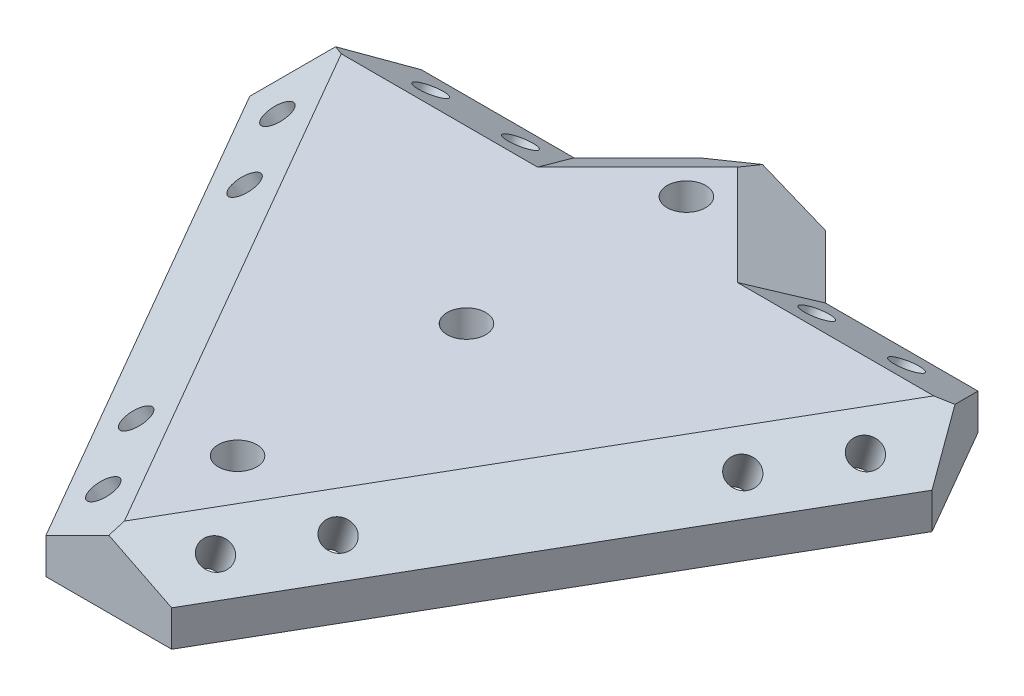
from build123d import *

# Parameters (mm, degrees)
SKETCH1_R           = 2.15
BOSS_EXTRUDE1_DEPTH = 8
CHAMFER1_SIZE       = 4
CHAMFER1_SIZE_2     = 6.92820323
CUT_EXTRUDE1_REACH  = 62.128
SKETCH2_R           = 1.6
CUT_EXTRUDE2_REACH  = 68.128
CUT_EXTRUDE2_START  = -6
SKETCH3_R           = 3
CIRPATTERN1_COUNT   = 3


with BuildPart() as part:
    # Sketch1 → Boss-Extrude1 (new body)
    with BuildSketch(Plane(origin=(0, 0, 0), x_dir=(1, 0, 0), z_dir=(0, 1, 0))):
        Polygon((-31, 25.980762114), (-14, 25.980762114), (-7, 32.980762114), (7, 32.980762114), (14, 25.980762114), (31, 25.980762114), (38, 13.856406461), (7, -39.837168574), (-7, -39.837168574), (-38, 13.856406461), align=None)
        with Locations(Location((0, 24.5, 0), (0, 0, 270))):
            Circle(SKETCH1_R, mode=Mode.SUBTRACT)
        with Locations(Location((0, -25.5, 0), (0, 0, 270))):
            Circle(SKETCH1_R, mode=Mode.SUBTRACT)
        with Locations(Location((0, 0, 0), (0, 0, 270))):
            Circle(SKETCH1_R, mode=Mode.SUBTRACT)
    extrude(amount=BOSS_EXTRUDE1_DEPTH)

    # Chamfer1
    # the kernel refuses this chamfer: 6.92820323, 4 mm, written as the material it takes off along each edge
    with BuildSketch(Plane(origin=(46.961927941, 8, -29.378920988), x_dir=(0.05013755556391488, -0.9983227437537926, 0.028946931201335895), z_dir=(-0.49999999999999767, 0, 0.86602540378444)), Plane(origin=(1.961927941, 8, 55.359683102), x_dir=(-0.05013755556391399, -0.9983227437537926, 0.02894693120133537), z_dir=(-0.49999999999999756, 0, -0.8660254037844402))) as chamfer1_piece_1:
        Polygon((CHAMFER1_SIZE * 0.998322743754, -CHAMFER1_SIZE * 0.0578938624027), (-CHAMFER1_SIZE_2 * 0.057893862405, -CHAMFER1_SIZE_2 * 0.998322743793), (0, 0), align=None)
    extrude(amount=97.847711765, mode=Mode.SUBTRACT)
    with BuildSketch(Plane(origin=(-3.923855882, 8, -25.980762114), x_dir=(0, -0.9983227437537926, -0.05789386240267147), z_dir=(1, 0, 0))) as chamfer1_piece_2_section:
        Polygon((CHAMFER1_SIZE * 0.998322743754, -CHAMFER1_SIZE * 0.0578938624027), (-CHAMFER1_SIZE_2 * 0.057893862405, -CHAMFER1_SIZE_2 * 0.998322743793), (0, 0), align=None)
    chamfer1_piece_2 = extrude(amount=52.847711765, mode=Mode.PRIVATE)
    chamfer1_piece_2 = split(chamfer1_piece_2, bisect_by=Plane(origin=(24.400878633, 6.686948716, -15.57988348), z_dir=(0.7071067811865477, 0, -0.7071067811865475)), keep=Keep.TOP, mode=Mode.PRIVATE)
    add(chamfer1_piece_2, mode=Mode.SUBTRACT)
    with BuildSketch(Plane(origin=(-5.674080039, 8, -45.654842153), x_dir=(0.04093714269400996, -0.9983227437537926, -0.04093714269400995), z_dir=(0.7071067811865475, 0, 0.7071067811865477))) as chamfer1_piece_3_section:
        Polygon((CHAMFER1_SIZE * 0.998322743754, -CHAMFER1_SIZE * 0.0578938624027), (-CHAMFER1_SIZE_2 * 0.057893862405, -CHAMFER1_SIZE_2 * 0.998322743793), (0, 0), align=None)
    chamfer1_piece_3 = extrude(amount=45.747206701, mode=Mode.PRIVATE)
    chamfer1_piece_3 = split(chamfer1_piece_3, bisect_by=Plane(origin=(1.830005366, 6.678491599, -25.980762114), z_dir=(0, 0, -1)), keep=Keep.TOP, mode=Mode.PRIVATE)
    add(chamfer1_piece_3, mode=Mode.SUBTRACT)
    with BuildSketch(Plane(origin=(-26.674080039, 8, -13.306682074), x_dir=(-0.04093714269400995, -0.9983227437537926, -0.04093714269400996), z_dir=(0.7071067811865477, 0, -0.7071067811865474))) as chamfer1_piece_4_section:
        Polygon((CHAMFER1_SIZE * 0.998322743754, -CHAMFER1_SIZE * 0.0578938624027), (-CHAMFER1_SIZE_2 * 0.057893862405, -CHAMFER1_SIZE_2 * 0.998322743793), (0, 0), align=None)
    chamfer1_piece_4 = extrude(amount=45.747206701, mode=Mode.PRIVATE)
    chamfer1_piece_4 = split(chamfer1_piece_4, bisect_by=Plane(origin=(-1.830005366, 6.678491599, -25.980762114), z_dir=(0, 0, -1)), keep=Keep.TOP, mode=Mode.PRIVATE)
    add(chamfer1_piece_4, mode=Mode.SUBTRACT)
    with BuildSketch(Plane(origin=(-48.923855882, 8, -25.980762114), x_dir=(0, -0.9983227437537926, -0.05789386240267147), z_dir=(1, 0, 0))) as chamfer1_piece_5_section:
        Polygon((CHAMFER1_SIZE * 0.998322743754, -CHAMFER1_SIZE * 0.0578938624027), (-CHAMFER1_SIZE_2 * 0.057893862405, -CHAMFER1_SIZE_2 * 0.998322743793), (0, 0), align=None)
    chamfer1_piece_5 = extrude(amount=52.847711765, mode=Mode.PRIVATE)
    chamfer1_piece_5 = split(chamfer1_piece_5, bisect_by=Plane(origin=(-24.400878633, 6.686948716, -15.57988348), z_dir=(-0.7071067811865474, 0, -0.7071067811865477)), keep=Keep.TOP, mode=Mode.PRIVATE)
    add(chamfer1_piece_5, mode=Mode.SUBTRACT)
    with BuildSketch(Plane(origin=(-5.674080039, 8, -45.654842153), x_dir=(0.04093714269400996, -0.9983227437537926, -0.04093714269400995), z_dir=(0.7071067811865475, 0, 0.7071067811865477))) as chamfer1_piece_6a_section:
        Polygon((CHAMFER1_SIZE * 0.998322743754, -CHAMFER1_SIZE * 0.0578938624027), (-CHAMFER1_SIZE_2 * 0.057893862405, -CHAMFER1_SIZE_2 * 0.998322743793), (0, 0), align=None)
    chamfer1_piece_6a = extrude(amount=45.747206701, mode=Mode.PRIVATE)
    chamfer1_piece_6a = split(chamfer1_piece_6a, bisect_by=Plane(origin=(17.706766412, 6.766221652, -25.980762114), z_dir=(0, 0, 1)), keep=Keep.TOP, mode=Mode.PRIVATE)
    with BuildSketch(Plane(origin=(-3.923855882, 8, -25.980762114), x_dir=(0, -0.9983227437537926, -0.05789386240267147), z_dir=(1, 0, 0))) as chamfer1_piece_6b_section:
        Polygon((CHAMFER1_SIZE * 0.998322743754, -CHAMFER1_SIZE * 0.0578938624027), (-CHAMFER1_SIZE_2 * 0.057893862405, -CHAMFER1_SIZE_2 * 0.998322743793), (0, 0), align=None)
    chamfer1_piece_6b = extrude(amount=52.847711765, mode=Mode.PRIVATE)
    chamfer1_piece_6b = split(chamfer1_piece_6b, bisect_by=Plane(origin=(11.378920334, 6.766221652, -28.60184178), z_dir=(-0.7071067811865477, 0, 0.7071067811865475)), keep=Keep.TOP, mode=Mode.PRIVATE)
    chamfer1_piece_6 = chamfer1_piece_6a & chamfer1_piece_6b
    add(chamfer1_piece_6, mode=Mode.SUBTRACT)
    with BuildSketch(Plane(origin=(-48.923855882, 8, -25.980762114), x_dir=(0, -0.9983227437537926, -0.05789386240267147), z_dir=(1, 0, 0))) as chamfer1_piece_7a_section:
        Polygon((CHAMFER1_SIZE * 0.998322743754, -CHAMFER1_SIZE * 0.0578938624027), (-CHAMFER1_SIZE_2 * 0.057893862405, -CHAMFER1_SIZE_2 * 0.998322743793), (0, 0), align=None)
    chamfer1_piece_7a = extrude(amount=52.847711765, mode=Mode.PRIVATE)
    chamfer1_piece_7a = split(chamfer1_piece_7a, bisect_by=Plane(origin=(-11.378920334, 6.766221652, -28.60184178), z_dir=(0.7071067811865474, 0, 0.7071067811865477)), keep=Keep.TOP, mode=Mode.PRIVATE)
    with BuildSketch(Plane(origin=(-26.674080039, 8, -13.306682074), x_dir=(-0.04093714269400995, -0.9983227437537926, -0.04093714269400996), z_dir=(0.7071067811865477, 0, -0.7071067811865474))) as chamfer1_piece_7b_section:
        Polygon((CHAMFER1_SIZE * 0.998322743754, -CHAMFER1_SIZE * 0.0578938624027), (-CHAMFER1_SIZE_2 * 0.057893862405, -CHAMFER1_SIZE_2 * 0.998322743793), (0, 0), align=None)
    chamfer1_piece_7b = extrude(amount=45.747206701, mode=Mode.PRIVATE)
    chamfer1_piece_7b = split(chamfer1_piece_7b, bisect_by=Plane(origin=(-17.706766412, 6.766221652, -25.980762114), z_dir=(0, 0, 1)), keep=Keep.TOP, mode=Mode.PRIVATE)
    chamfer1_piece_7 = chamfer1_piece_7a & chamfer1_piece_7b
    add(chamfer1_piece_7, mode=Mode.SUBTRACT)

    # Cut-Extrude1: up to this plane
    cut_extrude1_end = Plane(origin=(0, 0, 0), z_dir=(0, -1, 0))
    # Sketch2 → Cut-Extrude1 (cut, up to the surface)
    with BuildSketch(Plane(origin=(7.125, 14.25, 4.113620668), x_dir=(0.9013878188659966, -0.41602514716892336, -0.12009611535381544), z_dir=(0.43301270189222085, 0.8660254037844383, 0.24999999999999917)), mode=Mode.PRIVATE) as cut_extrude1_sk1:
        with Locations(Location((28.428385057, 12.896779562, 0), (0, 0, 172.874983651))):
            Circle(SKETCH2_R)
    cut_extrude1_tool1 = split(extrude(cut_extrude1_sk1.sketch, amount=-CUT_EXTRUDE1_REACH, mode=Mode.PRIVATE), bisect_by=cut_extrude1_end, keep=Keep.BOTH, mode=Mode.PRIVATE)
    # Sketch2 → Cut-Extrude1 (cut, up to the surface)
    with BuildSketch(Plane(origin=(7.125, 14.25, 4.113620668), x_dir=(0.9013878188659966, -0.41602514716892336, -0.12009611535381544), z_dir=(0.43301270189222085, 0.8660254037844383, 0.24999999999999917)), mode=Mode.PRIVATE) as cut_extrude1_sk2:
        with Locations(Location((-0.970725343, -31.201886038, 0), (0, 0, 172.874983651))):
            Circle(SKETCH2_R)
    cut_extrude1_tool2 = split(extrude(cut_extrude1_sk2.sketch, amount=-CUT_EXTRUDE1_REACH, mode=Mode.PRIVATE), bisect_by=cut_extrude1_end, keep=Keep.BOTH, mode=Mode.PRIVATE)
    # Sketch2 → Cut-Extrude1 (cut, up to the surface)
    with BuildSketch(Plane(origin=(7.125, 14.25, 4.113620668), x_dir=(0.9013878188659966, -0.41602514716892336, -0.12009611535381544), z_dir=(0.43301270189222085, 0.8660254037844383, 0.24999999999999917)), mode=Mode.PRIVATE) as cut_extrude1_sk3:
        with Locations(Location((4.576276619, -22.881383094, 0), (0, 0, 172.874983651))):
            Circle(SKETCH2_R)
    cut_extrude1_tool3 = split(extrude(cut_extrude1_sk3.sketch, amount=-CUT_EXTRUDE1_REACH, mode=Mode.PRIVATE), bisect_by=cut_extrude1_end, keep=Keep.BOTH, mode=Mode.PRIVATE)
    # Sketch2 → Cut-Extrude1 (cut, up to the surface)
    with BuildSketch(Plane(origin=(7.125, 14.25, 4.113620668), x_dir=(0.9013878188659966, -0.41602514716892336, -0.12009611535381544), z_dir=(0.43301270189222085, 0.8660254037844383, 0.24999999999999917)), mode=Mode.PRIVATE) as cut_extrude1_sk4:
        with Locations(Location((22.881383094, 4.576276619, 0), (0, 0, 172.874983651))):
            Circle(SKETCH2_R)
    cut_extrude1_tool4 = split(extrude(cut_extrude1_sk4.sketch, amount=-CUT_EXTRUDE1_REACH, mode=Mode.PRIVATE), bisect_by=cut_extrude1_end, keep=Keep.BOTH, mode=Mode.PRIVATE)
    cut_extrude1 = cut_extrude1_tool1.solids().sort_by_distance((32.75, 6, -11.691343))[0] + cut_extrude1_tool2.solids().sort_by_distance((6.25, 6, 34.208003))[0] + cut_extrude1_tool3.solids().sort_by_distance((11.25, 6, 25.547749))[0] + cut_extrude1_tool4.solids().sort_by_distance((27.75, 6, -3.031089))[0]
    add(cut_extrude1, mode=Mode.SUBTRACT)

    # Sketch3 → Cut-Extrude2 (cut, up to next)
    with BuildSketch(Plane(origin=(7.125, 14.25, 4.113620668), x_dir=(0.9013878188659967, -0.41602514716892325, -0.12009611535381544), z_dir=(0.43301270189222074, 0.8660254037844383, 0.24999999999999925)).offset(CUT_EXTRUDE2_START), mode=Mode.PRIVATE) as cut_extrude2_sk1:
        with Locations((28.428385057, 12.896779562)):
            Circle(SKETCH3_R)
    cut_extrude2_tool1 = extrude(cut_extrude2_sk1.sketch, amount=-CUT_EXTRUDE2_REACH, mode=Mode.PRIVATE) & part.part
    # Sketch3 → Cut-Extrude2 (cut, up to next)
    with BuildSketch(Plane(origin=(7.125, 14.25, 4.113620668), x_dir=(0.9013878188659967, -0.41602514716892325, -0.12009611535381544), z_dir=(0.43301270189222074, 0.8660254037844383, 0.24999999999999925)).offset(CUT_EXTRUDE2_START), mode=Mode.PRIVATE) as cut_extrude2_sk2:
        with Locations((-0.970725343, -31.201886038)):
            Circle(SKETCH3_R)
    cut_extrude2_tool2 = extrude(cut_extrude2_sk2.sketch, amount=-CUT_EXTRUDE2_REACH, mode=Mode.PRIVATE) & part.part
    # Sketch3 → Cut-Extrude2 (cut, up to next)
    with BuildSketch(Plane(origin=(7.125, 14.25, 4.113620668), x_dir=(0.9013878188659967, -0.41602514716892325, -0.12009611535381544), z_dir=(0.43301270189222074, 0.8660254037844383, 0.24999999999999925)).offset(CUT_EXTRUDE2_START), mode=Mode.PRIVATE) as cut_extrude2_sk3:
        with Locations((22.881383094, 4.576276619)):
            Circle(SKETCH3_R)
    cut_extrude2_tool3 = extrude(cut_extrude2_sk3.sketch, amount=-CUT_EXTRUDE2_REACH, mode=Mode.PRIVATE) & part.part
    # Sketch3 → Cut-Extrude2 (cut, up to next)
    with BuildSketch(Plane(origin=(7.125, 14.25, 4.113620668), x_dir=(0.9013878188659967, -0.41602514716892325, -0.12009611535381544), z_dir=(0.43301270189222074, 0.8660254037844383, 0.24999999999999925)).offset(CUT_EXTRUDE2_START), mode=Mode.PRIVATE) as cut_extrude2_sk4:
        with Locations((4.576276619, -22.881383094)):
            Circle(SKETCH3_R)
    cut_extrude2_tool4 = extrude(cut_extrude2_sk4.sketch, amount=-CUT_EXTRUDE2_REACH, mode=Mode.PRIVATE) & part.part
    cut_extrude2_1 = cut_extrude2_tool1.solids().sort_by_distance((30.151924, 0.803848, -13.191343))[0]
    add(cut_extrude2_1, mode=Mode.SUBTRACT)
    cut_extrude2_2 = cut_extrude2_tool2.solids().sort_by_distance((3.651924, 0.803848, 32.708003))[0]
    add(cut_extrude2_2, mode=Mode.SUBTRACT)
    cut_extrude2_3 = cut_extrude2_tool3.solids().sort_by_distance((25.151924, 0.803848, -4.531089))[0]
    add(cut_extrude2_3, mode=Mode.SUBTRACT)
    cut_extrude2_4 = cut_extrude2_tool4.solids().sort_by_distance((8.651924, 0.803848, 24.047749))[0]
    add(cut_extrude2_4, mode=Mode.SUBTRACT)
    cut_extrude2 = cut_extrude2_1 + cut_extrude2_2 + cut_extrude2_3 + cut_extrude2_4  # Cut-Extrude2 as one shape, for the pattern or mirror that repeats it

    # CirPattern1: Cut-Extrude1, Cut-Extrude2 ×3 about axis
    cirpattern1_axis = Axis((0, 0, 0), (0, 1, 0))
    add([cut_extrude1.rotate(cirpattern1_axis, i * 360 / CIRPATTERN1_COUNT) for i in range(1, CIRPATTERN1_COUNT)], mode=Mode.SUBTRACT)
    add([cut_extrude2.rotate(cirpattern1_axis, i * 360 / CIRPATTERN1_COUNT) for i in range(1, CIRPATTERN1_COUNT)], mode=Mode.SUBTRACT)


solid = part.part
